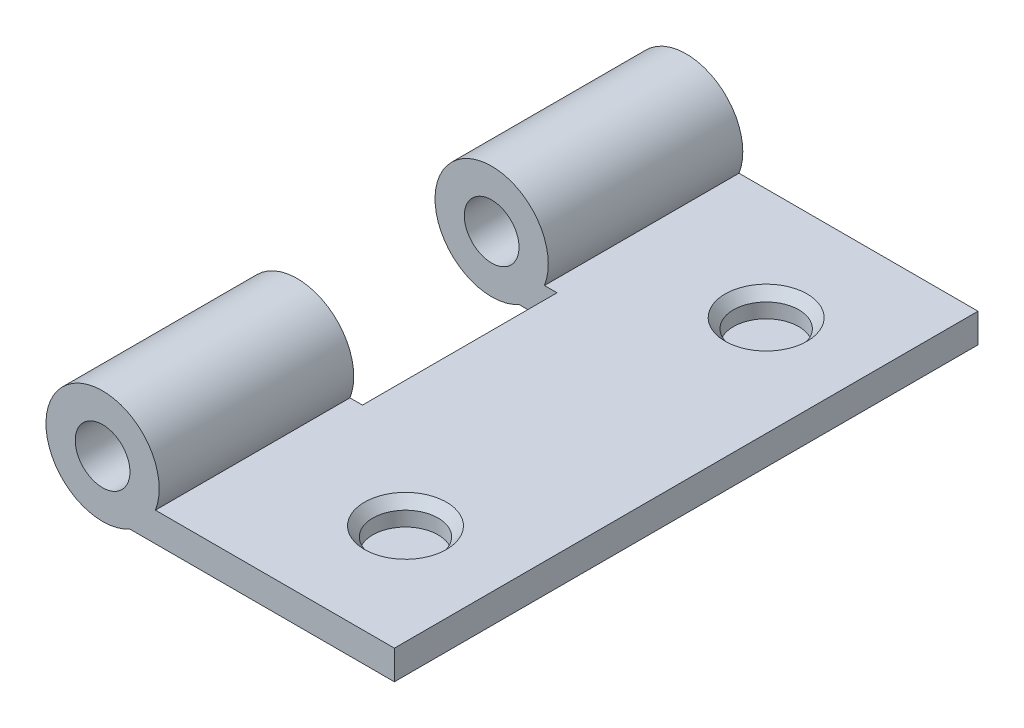
from build123d import *
from OCP.BRepFilletAPI import BRepFilletAPI_MakeChamfer

# Parameters (mm, degrees)
SKETCH1_R           = 1.190625
EXTRUDE1_DEPTH      = 12.7
SKETCH1_W           = 9.8552
SKETCH1_H           = 1.27
EXTRUDE1_2_DEPTH    = 12.7
SKETCH20_R          = 1.4224
EXTRUDE24_DEPTH     = 20.045522232
CHAMFER2_SIZE       = 0.635
CHAMFER2_SIZE2      = 0.551997079
EXTRUDE4_DEPTH      = 19.94700397
EXTRUDE4_DEPTH_BACK = 19.94700397
SKETCH8_W           = 5.6896
SKETCH8_H           = 8.466666666
SKETCH9_R           = 1.190625
EXTRUDE5_DEPTH      = 8.466666667


# Read off the part's stored shape, not the designer's step: Mirror2
with BuildPart() as part:
    # Sketch1 → Extrude1 (new, symmetric)
    with BuildSketch(Plane.XY):
        with BuildLine():
            Line((12.7, -2.157017049), (1.190625, -2.157017049))
            ThreePointArc((1.190625, -2.157017049), (-1.856577095, 1.619701185), (2.298588957, -0.887017049))
            Line((2.298588957, -0.887017049), (12.7, -0.887017049))
            Line((12.7, -0.887017049), (12.7, -2.157017049))
        make_face()
        Circle(SKETCH1_R, mode=Mode.SUBTRACT)
    extrude(amount=EXTRUDE1_DEPTH, both=True)

    # Mirror2 outline → Mirror2 (revolve, cut)
    with BuildSketch(Plane(origin=(8.3312, 0, -7.8486), x_dir=(1, 0, 0), z_dir=(0, 0, 1))):
        Polygon((1.784715731, -0.887017049), (0, -0.887017049), (0, -1.93881362), (1.4224, -1.93881362), (1.4224, -1.30381362), align=None)
    revolve(axis=Axis((8.3312, 0, -7.8486), (0, 1, 0)), mode=Mode.SUBTRACT)

    # Mirror2 2 outline → Mirror2 2 (revolve, cut)
    with BuildSketch(Plane(origin=(8.3312, 0, 7.8486), x_dir=(1, 0, 0), z_dir=(0, 0, 1))):
        Polygon((0, -0.887017049), (0, -1.93881362), (1.4224, -1.93881362), (1.4224, -1.30381362), (1.784715731, -0.887017049), align=None)
    revolve(axis=Axis((8.3312, 0, 7.8486), (0, 1, 0)), mode=Mode.SUBTRACT)

    # Sketch8 → Extrude4 (cut, two sides: drawn at the far end of the back side and taken through both)
    with BuildSketch(Plane(origin=(0, 0, 0), x_dir=(1, 0, 0), z_dir=(0, 1, 0)).offset(-EXTRUDE4_DEPTH_BACK)):
        Rectangle(SKETCH8_W, SKETCH8_H)
    extrude(amount=EXTRUDE4_DEPTH + EXTRUDE4_DEPTH_BACK, mode=Mode.SUBTRACT)


with BuildPart() as body_2:
    # Sketch1 → Extrude1 2 (new, symmetric)
    with BuildSketch(Plane.XY):
        with Locations((-7.7724, -1.30381362)):
            Rectangle(SKETCH1_W, SKETCH1_H)
    extrude(amount=EXTRUDE1_2_DEPTH, both=True)

    # Sketch20 → Extrude24 (cut, through all)
    with BuildSketch(Plane(origin=(0, -0.66881362, 0), x_dir=(1, 0, 0), z_dir=(0, 1, 0))):
        with Locations(Location((-8.3312, 7.8486, 0), (0, 0, 270))):
            Circle(SKETCH20_R)
        with Locations(Location((-8.3312, -7.8486, 0), (0, 0, 270))):
            Circle(SKETCH20_R)
    extrude(amount=-EXTRUDE24_DEPTH, mode=Mode.SUBTRACT)

    # Chamfer2: one chamfer whose edges measure the first distance from different faces: ONE call of the kernel's chamfer builder (chamfer() names one face for all edges)
    chamfer2_edges_1 = [body_2.edges().sort_by_distance(p)[0] for p in [
        (-8.3312, -0.66881362, -9.271),
    ]]
    chamfer2_side_1 = [body_2.faces().sort_by_distance(p)[0] for p in [
        (-8.3312, -1.30381362, -9.271),
    ]]
    chamfer2_edges_2 = [body_2.edges().sort_by_distance(p)[0] for p in [
        (-8.3312, -0.66881362, 6.4262),
    ]]
    chamfer2_side_2 = [body_2.faces().sort_by_distance(p)[0] for p in [
        (-8.3312, -1.30381362, 6.4262),
    ]]
    chamfer2 = BRepFilletAPI_MakeChamfer(body_2.part.solid().wrapped)
    for e in chamfer2_edges_1:
        chamfer2.Add(CHAMFER2_SIZE, CHAMFER2_SIZE2, e.wrapped, chamfer2_side_1[0].wrapped)  # the first distance lies on this face
    for e in chamfer2_edges_2:
        chamfer2.Add(CHAMFER2_SIZE, CHAMFER2_SIZE2, e.wrapped, chamfer2_side_2[0].wrapped)  # the first distance lies on this face
    add(Compound.cast(chamfer2.Shape()), mode=Mode.REPLACE)

    # Sketch9 → Extrude5 (add)
    with BuildSketch(Plane.XY.offset(-4.233333333)):
        with BuildLine():
            Line((-2.371286314, -0.66881362), (-2.8448, -0.66881362))
            Line((-2.8448, -0.66881362), (-2.8448, -1.93881362))
            Line((-2.8448, -1.93881362), (-1.520300032, -1.93881362))
            ThreePointArc((-1.520300032, -1.93881362), (2.046786768, 1.371486189), (-2.371286314, -0.66881362))
        make_face()
        with Locations(Location((0, 0, 0), (0, 0, 180))):
            Circle(SKETCH9_R, mode=Mode.SUBTRACT)
    extrude(amount=EXTRUDE5_DEPTH)


with BuildPart() as body_3:
    # Sketch6 → Revolve1 (revolve)
    with BuildSketch(Plane(origin=(0, 0, 0), x_dir=(1, 0, 0), z_dir=(0, 1, 0))):
        with BuildLine():
            Line((-2.4638, -12.7), (-2.4638, -13.2715))
            ThreePointArc((-2.4638, -13.2715), (-1.264606924, -13.698253184), (0, -13.843))
            Line((0, -13.843), (0, 13.843))
            ThreePointArc((0, 13.843), (-1.264606924, 13.698253184), (-2.4638, 13.2715))
            Line((-2.4638, 13.2715), (-2.4638, 12.7))
            Line((-2.4638, 12.7), (-1.190625, 12.7))
            Line((-1.190625, 12.7), (-1.190625, -12.7))
            Line((-1.190625, -12.7), (-2.4638, -12.7))
        make_face()
    revolve(axis=Axis((0, 0, -13.843), (0, 0, 1)))


solid = part.part
